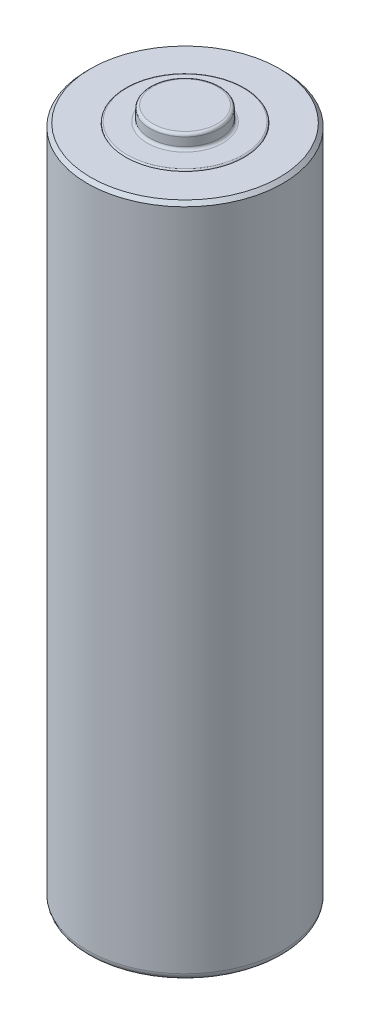
from build123d import *

# Parameters (mm, degrees)
BOSS_EXTRUDE1_DEPTH      = 24.15
BOSS_EXTRUDE1_DEPTH_BACK = 24.15
SKETCH1_R                = 7
FILLET1_R                = 0.5
CHAMFER1_SIZE            = 0.25
SKETCH2_R                = 4.25
BOSS_EXTRUDE2_DEPTH      = 0.1
FILLET2_R                = 0.1
SKETCH3_R                = 2.5
BOSS_EXTRUDE3_DEPTH      = 1
FILLET3_R                = 0.2
FILLET4_R                = 0.2


with BuildPart() as part:
    # Sketch1 → Boss-Extrude1 (new, two sides: drawn at the far end of the back side and taken through both)
    with BuildSketch(Plane(origin=(0, 0, 0), x_dir=(1, 0, 0), z_dir=(0, 1, 0)).offset(-BOSS_EXTRUDE1_DEPTH_BACK)):
        with Locations(Location((0, 0, 0), (0, 0, 270))):
            Circle(SKETCH1_R)
    extrude(amount=BOSS_EXTRUDE1_DEPTH + BOSS_EXTRUDE1_DEPTH_BACK)

    # Fillet1
    fillet1_edges = [part.edges().sort_by_distance(p)[0] for p in [
        (0, -24.15, -7),
    ]]
    fillet(fillet1_edges, radius=FILLET1_R)

    # Chamfer1
    chamfer1_edges = [part.edges().sort_by_distance(p)[0] for p in [
        (0, 24.15, -7),
    ]]
    chamfer(chamfer1_edges, length=CHAMFER1_SIZE)

    # Sketch2 → Boss-Extrude2 (add)
    with BuildSketch(Plane(origin=(0, 24.15, 0), x_dir=(1, 0, 0), z_dir=(0, 1, 0))):
        with Locations(Location((0, 0, 0), (0, 0, 270))):
            Circle(SKETCH2_R)
    extrude(amount=BOSS_EXTRUDE2_DEPTH)

    # Fillet2
    fillet2_edges = [part.edges().sort_by_distance(p)[0] for p in [
        (0, 24.25, -4.25),
    ]]
    fillet(fillet2_edges, radius=FILLET2_R - 0.0001)  # a hair under: the kernel refuses the full size

    # Sketch3 → Boss-Extrude3 (add)
    with BuildSketch(Plane(origin=(0, 24.25, 0), x_dir=(1, 0, 0), z_dir=(0, 1, 0))):
        with Locations(Location((0, 0, 0), (0, 0, 270))):
            Circle(SKETCH3_R)
    extrude(amount=BOSS_EXTRUDE3_DEPTH)

    # Fillet3
    fillet3_edges = [part.edges().sort_by_distance(p)[0] for p in [
        (0, 24.25, -2.5),
    ]]
    fillet(fillet3_edges, radius=FILLET3_R)

    # Fillet4
    fillet4_edges = [part.edges().sort_by_distance(p)[0] for p in [
        (0, 25.25, -2.5),
    ]]
    fillet(fillet4_edges, radius=FILLET4_R)


solid = part.part
